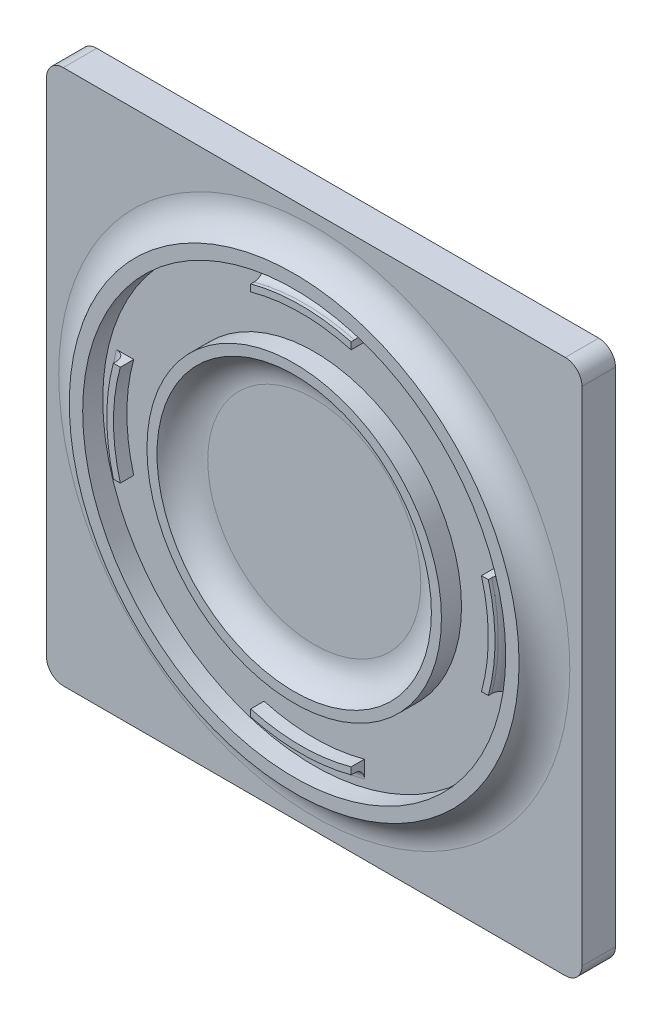
from build123d import *

# Parameters (mm, degrees)
SKETCH1_W           = 80
SKETCH1_H           = 80
BOSS_EXTRUDE1_DEPTH = 5
FILLET1_R           = 2.5
BOSS_EXTRUDE5_DEPTH = 2
SKETCH12_R          = 33.6
SKETCH12_R_2        = 31.6
BOSS_EXTRUDE8_DEPTH = 3
SKETCH13_R          = 22
SKETCH13_R_2        = 20.5
BOSS_EXTRUDE9_DEPTH = 3
FILLET2_R           = 1.5
FILLET3_R           = 5


with BuildPart() as part:
    # Sketch1 → Boss-Extrude1 (new body)
    with BuildSketch(Plane.XY):
        Rectangle(SKETCH1_W, SKETCH1_H)
    extrude(amount=BOSS_EXTRUDE1_DEPTH)

    # Fillet1
    fillet1_edges = [part.edges().sort_by_distance(p)[0] for p in [
        (40, -40, 2.5),
        (-40, -40, 2.5),
        (-40, 40, 2.5),
        (40, 40, 2.5),
    ]]
    fillet(fillet1_edges, radius=FILLET1_R)

    # Sketch5 → Boss-Extrude5 (add)
    with BuildSketch(Plane.XY.offset(5)):
        with BuildLine():
            ThreePointArc((7.5, 28.013389656), (3.782307496, 28.752289474), (0, 29))
            ThreePointArc((0, 29), (-3.782307496, 28.752289474), (-7.5, 28.013389656))
            Line((-7.5, 28.013389656), (-7.5, 26.97684192))
            ThreePointArc((-7.5, 26.97684192), (0, 28), (7.5, 26.97684192))
            Line((7.5, 26.97684192), (7.5, 28.013389656))
        make_face()
        with BuildLine():
            ThreePointArc((7.5, -26.97684192), (0, -28), (-7.5, -26.97684192))
            Line((-7.5, -26.97684192), (-7.5, -28.013389656))
            ThreePointArc((-7.5, -28.013389656), (-3.782307496, -28.752289474), (0, -29))
            ThreePointArc((0, -29), (3.782307496, -28.752289474), (7.5, -28.013389656))
            Line((7.5, -28.013389656), (7.5, -26.97684192))
        make_face()
        with BuildLine():
            Line((-26.97684192, 7.5), (-28.013389656, 7.5))
            ThreePointArc((-28.013389656, 7.5), (-28.752289466, 3.782307556), (-29, 1.22e-07))
            ThreePointArc((-29, 1.22e-07), (-28.752289482, -3.782307436), (-28.013389656, -7.5))
            Line((-28.013389656, -7.5), (-26.97684192, -7.5))
            ThreePointArc((-26.97684192, -7.5), (-28, 0), (-26.97684192, 7.5))
        make_face()
        with BuildLine():
            ThreePointArc((29, 0), (28.752289474, 3.782307496), (28.013389656, 7.5))
            Line((28.013389656, 7.5), (26.97684192, 7.5))
            ThreePointArc((26.97684192, 7.5), (27.743031321, 3.78473422), (28, 0))
            ThreePointArc((28, 0), (27.743031321, -3.78473422), (26.97684192, -7.5))
            Line((26.97684192, -7.5), (28.013389656, -7.5))
            ThreePointArc((28.013389656, -7.5), (28.752289474, -3.782307496), (29, 0))
        make_face()
    extrude(amount=BOSS_EXTRUDE5_DEPTH)

    # Sketch12 → Boss-Extrude8 (add)
    with BuildSketch(Plane.XY.offset(5)):
        Circle(SKETCH12_R)
        Circle(SKETCH12_R_2, mode=Mode.SUBTRACT)
    extrude(amount=BOSS_EXTRUDE8_DEPTH)

    # Sketch13 → Boss-Extrude9 (add)
    with BuildSketch(Plane.XY.offset(5)):
        Circle(SKETCH13_R)
        Circle(SKETCH13_R_2, mode=Mode.SUBTRACT)
    extrude(amount=BOSS_EXTRUDE9_DEPTH)

    # Fillet2
    fillet2_edges = [part.edges().sort_by_distance(p)[0] for p in [
        (0, 29, 5),
        (29, 0, 5),
        (-29, 0, 5),
        (0, -29, 5),
    ]]
    fillet(fillet2_edges, radius=FILLET2_R)

    # Fillet3
    # the kernel refuses this fillet: 5 mm, written as the material it adds along each edge
    with BuildSketch(Plane(origin=(0, 0, 5), x_dir=(1, 0, 0), z_dir=(0, -1, 0))) as fillet3_piece_1:
        with BuildLine():
            CenterArc((38.182575695, 5), FILLET3_R, 203.578178478, 66.421821522)
            Line((38.182575695, 0), (38.182575695, -0.1))
            Line((38.182575695, -0.1), (33.6, -0.1))
            Line((33.6, -0.1), (33.5, 0))
            ThreePointArc((33.5, 0), (33.5, 1.5), (33.508348486, 2.96))
            Line((33.508348486, 2.96), (33.6, 3))
        make_face()
    revolve(axis=Axis((0, 0, 5), (0, 0, 1)))
    with BuildSketch(Plane(origin=(0, 0, 5), x_dir=(1, 0, 0), z_dir=(0, -1, 0))) as fillet3_piece_2:
        with BuildLine():
            CenterArc((15.917424305, 5), FILLET3_R, 270, 66.421821522)
            Line((15.917424305, 0), (15.917424305, -0.1))
            Line((15.917424305, -0.1), (20.5, -0.1))
            Line((20.5, -0.1), (20.6, 0))
            ThreePointArc((20.6, 0), (20.6, 1.5), (20.591651514, 2.96))
            Line((20.591651514, 2.96), (20.5, 3))
        make_face()
    revolve(axis=Axis((0, 0, 5), (0, 0, 1)))


solid = part.part
